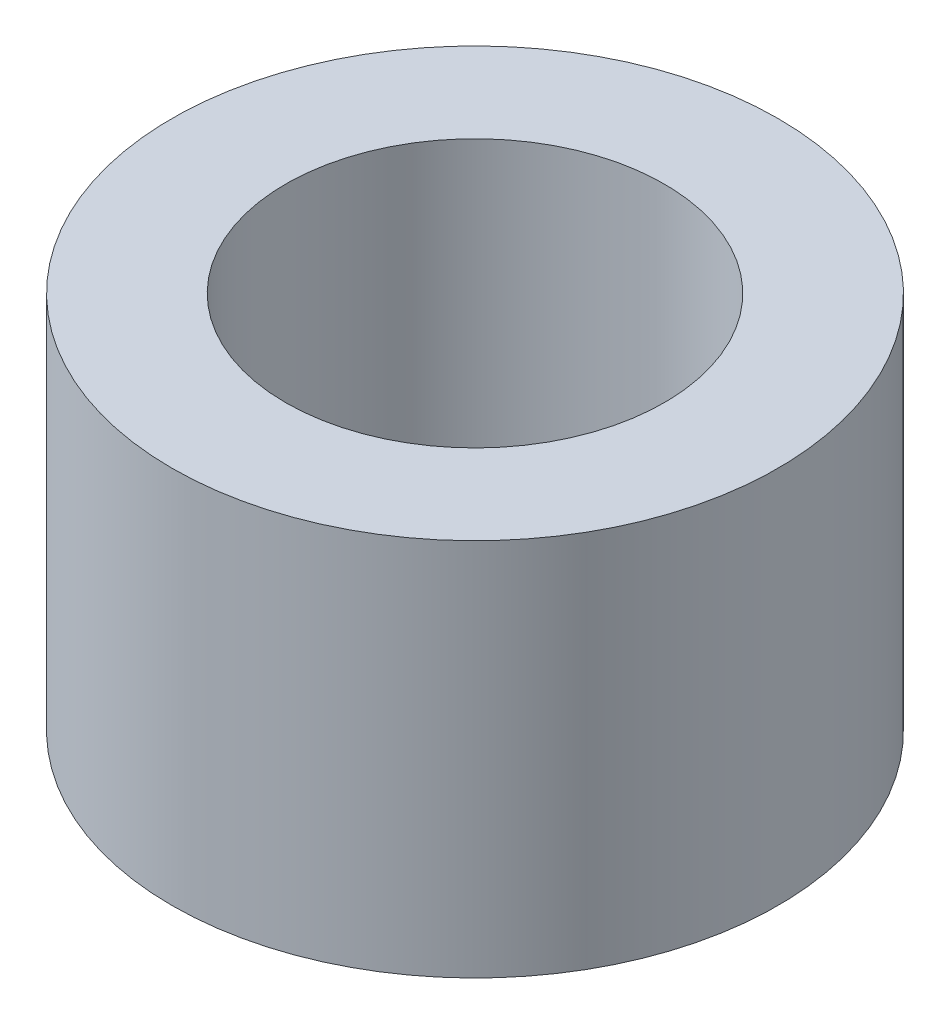
from build123d import *

# Parameters (mm, degrees)
SKETCH1_R           = 6.35
SKETCH1_R_2         = 3.96875
BOSS_EXTRUDE1_DEPTH = 7.9375


with BuildPart() as part:
    # Sketch1 → Boss-Extrude1 (new body)
    with BuildSketch(Plane(origin=(0, 0, 0), x_dir=(1, 0, 0), z_dir=(0, 1, 0))):
        Circle(SKETCH1_R)
        Circle(SKETCH1_R_2, mode=Mode.SUBTRACT)
    extrude(amount=BOSS_EXTRUDE1_DEPTH)


solid = part.part
